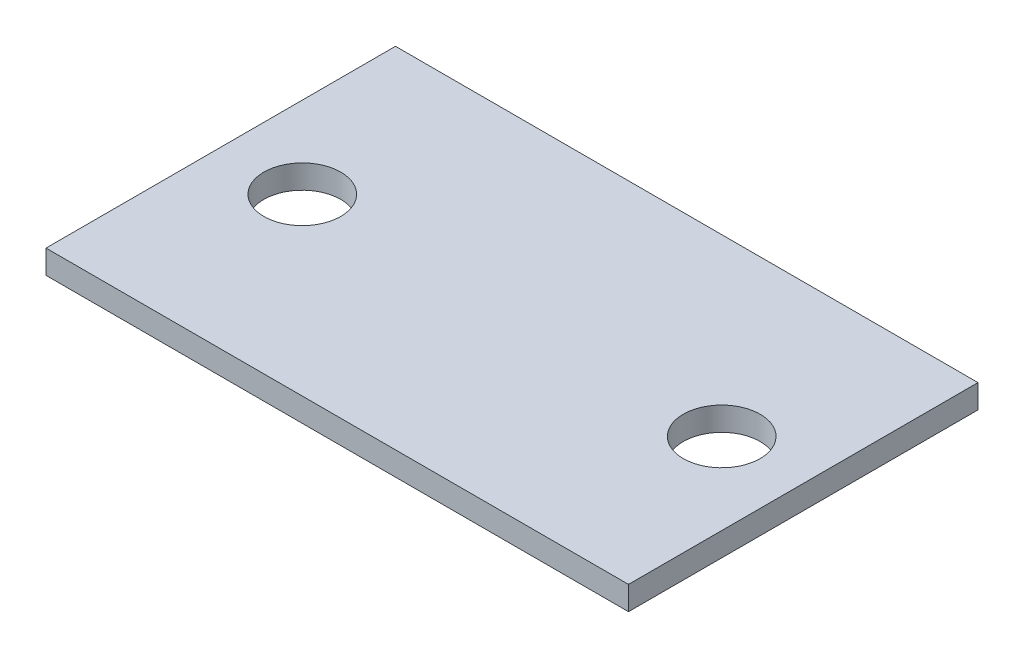
from build123d import *

# Parameters (mm, degrees)
SKETCH1_W           = 50
SKETCH1_H           = 30
BOSS_EXTRUDE1_DEPTH = 2.032
SKETCH2_R           = 3.3
CUT_EXTRUDE1_DEPTH  = 30.225485864


with BuildPart() as part:
    # Sketch1 → Boss-Extrude1 (new body)
    with BuildSketch(Plane(origin=(0, 0, 0), x_dir=(1, 0, 0), z_dir=(0, 1, 0))):
        Rectangle(SKETCH1_W, SKETCH1_H)
    extrude(amount=BOSS_EXTRUDE1_DEPTH)

    # Sketch2 → Cut-Extrude1 (cut, through all)
    with BuildSketch(Plane(origin=(0, 2.032, 0), x_dir=(1, 0, 0), z_dir=(0, 1, 0))):
        with Locations((18, 0)):
            Circle(SKETCH2_R)
        with Locations((-18, 0)):
            Circle(SKETCH2_R)
    extrude(amount=-CUT_EXTRUDE1_DEPTH, mode=Mode.SUBTRACT)


solid = part.part
